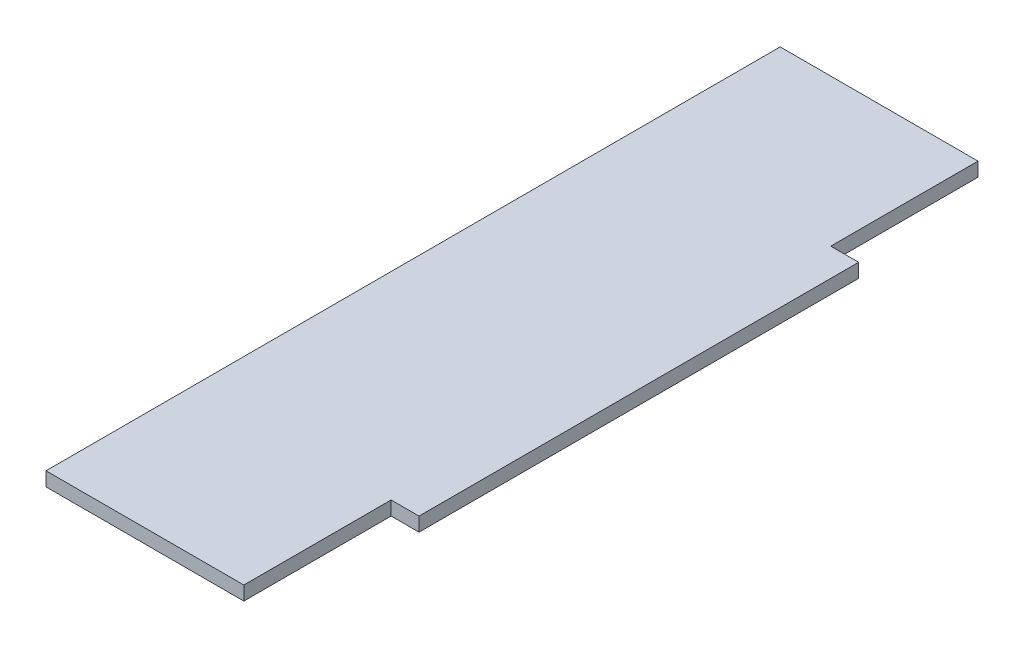
from build123d import *

# Parameters (mm, degrees)
BOSS_EXTRUDE1_DEPTH = 3.175


with BuildPart() as part:
    # Sketch1 → Boss-Extrude1 (new body)
    with BuildSketch(Plane(origin=(0, 0, 0), x_dir=(1, 0, 0), z_dir=(0, 1, 0))):
        Polygon((22.5, 33.5), (-22.5, 33.5), (-22.5, 0), (-22.5, -100), (-22.5, -133.5), (22.5, -133.5), (22.5, -100), (28.85, -100), (28.85, 0), (22.5, 0), align=None)
    extrude(amount=BOSS_EXTRUDE1_DEPTH)


solid = part.part
